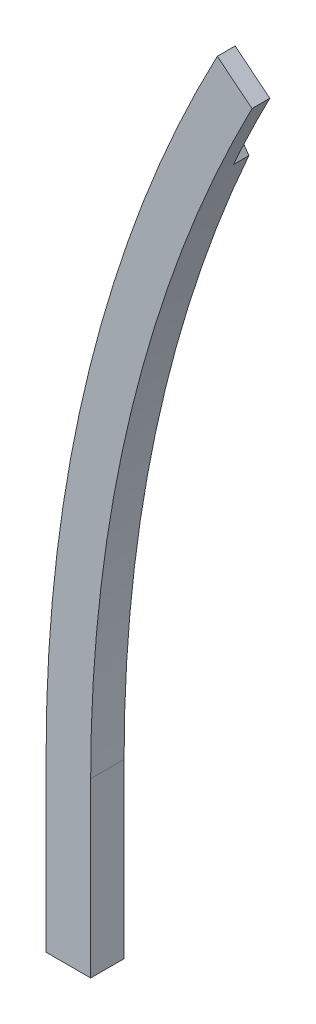
from build123d import *

# Parameters (mm, degrees)
BOSS_EXTRUDE1_DEPTH = 9.525
CUT_EXTRUDE5_DEPTH  = 4.445


with BuildPart() as part:
    # Sketch1 → Boss-Extrude1 (new body)
    with BuildSketch(Plane.XY):
        with BuildLine():
            Line((0, 0), (-12.699993357, 0))
            Line((-12.699993357, 0), (-12.699993357, 49.2125))
            ThreePointArc((-12.699993357, 49.2125), (-0.317515025, 150.404981393), (36.099232611, 245.6261164))
            Line((36.099232611, 245.6261164), (46.012551217, 237.687858058))
            ThreePointArc((46.012551217, 237.687858058), (11.669608557, 146.217803289), (0, 49.2125))
            Line((0, 49.2125), (0, 0))
        make_face()
    extrude(amount=BOSS_EXTRUDE1_DEPTH)

    # Sketch3 → Cut-Extrude5 (cut)
    with BuildSketch(Plane(origin=(0, 0, 0), x_dir=(-1, 0, 0), z_dir=(0, 0, -1))):
        with BuildLine():
            Line((-27.349448252, 228.130291752), (-35.581198353, 216.068210309))
            ThreePointArc((-35.581198353, 216.068210309), (-40.638238498, 226.954575259), (-46.012551217, 237.687858058))
            Line((-46.012551217, 237.687858058), (-36.099232611, 245.6261164))
            ThreePointArc((-36.099232611, 245.6261164), (-31.622387933, 236.929191234), (-27.349448252, 228.130291752))
        make_face()
    extrude(amount=-CUT_EXTRUDE5_DEPTH, mode=Mode.SUBTRACT)


solid = part.part
